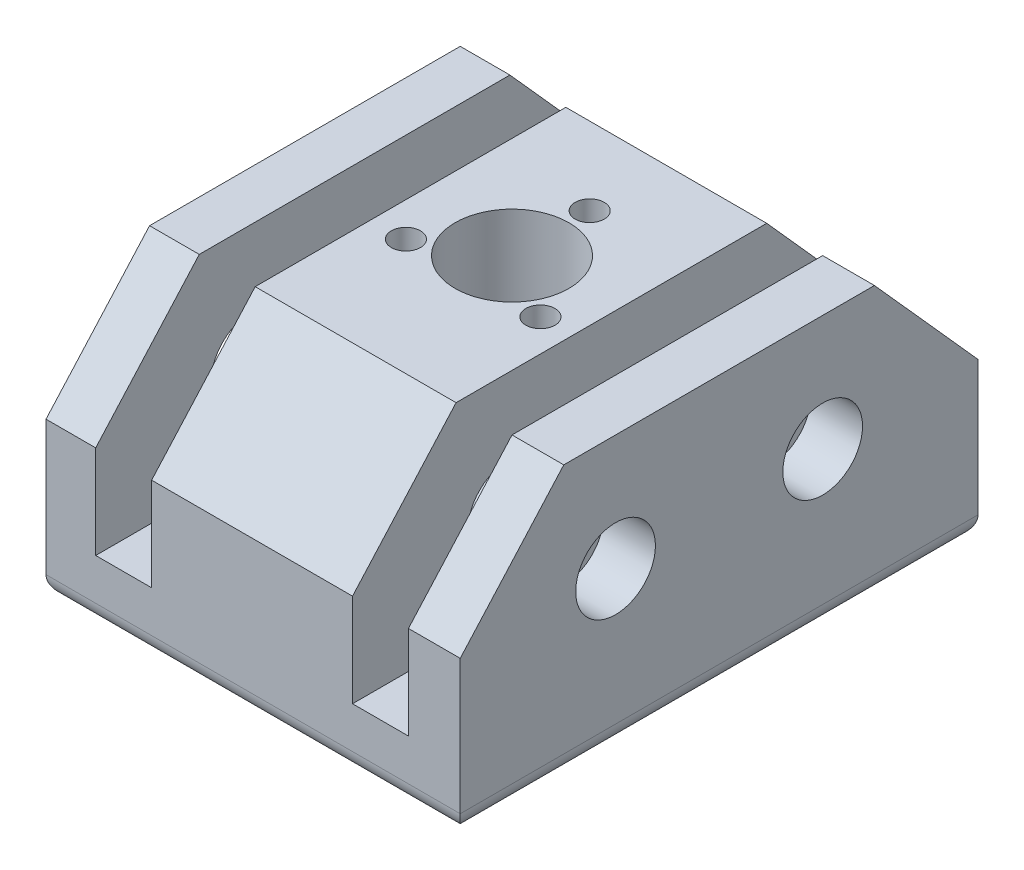
from build123d import *

# Parameters (mm, degrees)
SKETCH1_W           = 63.5
SKETCH1_H           = 6.35
BOSS_EXTRUDE1_DEPTH = 50.8
BOSS_EXTRUDE2_DEPTH = 50.8
SKETCH10_W          = 6.858
SKETCH10_H          = 25.629031657
CUT_EXTRUDE1_DEPTH  = 88.854357354
LPATTERN3_COUNT     = 2
LPATTERN3_PITCH     = 31.496
SKETCH11_R          = 4.8895
CUT_EXTRUDE2_DEPTH  = 88.854357354
FILLET1_R           = 2.54
SKETCH24_R          = 6.985
CUT_EXTRUDE10_DEPTH = 88.854357354
SKETCH25_R          = 13.97
CUT_EXTRUDE11_DEPTH = 5.08
CUT_EXTRUDE12_REACH = 88.06
SKETCH26_R          = 1.7859375


with BuildPart() as part:
    # Sketch1 → Boss-Extrude1 (new body)
    with BuildSketch(Plane(origin=(0, 0, 0), x_dir=(0, 0, -1), z_dir=(1, 0, 0))):
        with Locations((31.75, 3.175)):
            Rectangle(SKETCH1_W, SKETCH1_H)
    extrude(amount=-BOSS_EXTRUDE1_DEPTH)

    # Sketch2 → Boss-Extrude2 (add)
    with BuildSketch(Plane(origin=(0, 0, 0), x_dir=(0, 0, -1), z_dir=(1, 0, 0))):
        Polygon((0, 6.35), (0, 19.05), (12.7, 33.249031657), (50.8, 33.249031657), (63.5, 19.05), (63.5, 6.35), align=None)
    extrude(amount=-BOSS_EXTRUDE2_DEPTH)

    # Sketch10 → Cut-Extrude1 (cut, through all)
    with BuildSketch(Plane(origin=(0, 0, -63.5), x_dir=(-1, 0, 0), z_dir=(0, 0, -1))):
        with Locations((9.779, 20.434515829)):
            Rectangle(SKETCH10_W, SKETCH10_H)
    cut_extrude1 = extrude(amount=-CUT_EXTRUDE1_DEPTH, mode=Mode.SUBTRACT)

    # LPattern3: Cut-Extrude1 ×2
    with Locations(*[(-i * LPATTERN3_PITCH, 0, 0) for i in range(1, LPATTERN3_COUNT)]):
        add(cut_extrude1, mode=Mode.SUBTRACT)

    # Sketch11 → Cut-Extrude2 (cut, through all)
    with BuildSketch(Plane(origin=(0, 0, 0), x_dir=(0, 0, -1), z_dir=(1, 0, 0))):
        with Locations((19.05, 19.05)):
            Circle(SKETCH11_R)
        with Locations((44.45, 19.05)):
            Circle(SKETCH11_R)
    extrude(amount=-CUT_EXTRUDE2_DEPTH, mode=Mode.SUBTRACT)

    # Fillet1
    fillet1_edges = [part.edges().sort_by_distance(p)[0] for p in [
        (0, 0, -31.75),
        (-50.8, 0, -31.75),
        (-25.4, 0, 0),
        (-25.4, 0, -63.5),
    ]]
    fillet(fillet1_edges, radius=FILLET1_R)

    # Sketch24 → Cut-Extrude10 (cut, through all)
    with BuildSketch(Plane.XZ):
        with Locations((-25.4, -31.75)):
            Circle(SKETCH24_R)
    extrude(amount=-CUT_EXTRUDE10_DEPTH, mode=Mode.SUBTRACT)

    # Sketch25 → Cut-Extrude11 (cut)
    with BuildSketch(Plane.XZ):
        with Locations((-25.4, -31.75)):
            Circle(SKETCH25_R)
    extrude(amount=-CUT_EXTRUDE11_DEPTH, mode=Mode.SUBTRACT)

    # Sketch26 → Cut-Extrude12 (cut, up to next)
    with BuildSketch(Plane.XZ.offset(-5.08), mode=Mode.PRIVATE) as cut_extrude12_sk1:
        with Locations((-25.4, -41.275)):
            Circle(SKETCH26_R)
    cut_extrude12_tool1 = extrude(cut_extrude12_sk1.sketch, amount=-CUT_EXTRUDE12_REACH, mode=Mode.PRIVATE) & part.part
    # Sketch26 → Cut-Extrude12 (cut, up to next)
    with BuildSketch(Plane.XZ.offset(-5.08), mode=Mode.PRIVATE) as cut_extrude12_sk2:
        with Locations((-33.648891971, -26.9875)):
            Circle(SKETCH26_R)
    cut_extrude12_tool2 = extrude(cut_extrude12_sk2.sketch, amount=-CUT_EXTRUDE12_REACH, mode=Mode.PRIVATE) & part.part
    # Sketch26 → Cut-Extrude12 (cut, up to next)
    with BuildSketch(Plane.XZ.offset(-5.08), mode=Mode.PRIVATE) as cut_extrude12_sk3:
        with Locations((-17.151108029, -26.9875)):
            Circle(SKETCH26_R)
    cut_extrude12_tool3 = extrude(cut_extrude12_sk3.sketch, amount=-CUT_EXTRUDE12_REACH, mode=Mode.PRIVATE) & part.part
    add(cut_extrude12_tool1.solids().sort_by_distance((-25.4, 5.08, -41.275))[0], mode=Mode.SUBTRACT)
    add(cut_extrude12_tool2.solids().sort_by_distance((-33.648892, 5.08, -26.9875))[0], mode=Mode.SUBTRACT)
    add(cut_extrude12_tool3.solids().sort_by_distance((-17.151108, 5.08, -26.9875))[0], mode=Mode.SUBTRACT)


solid = part.part
